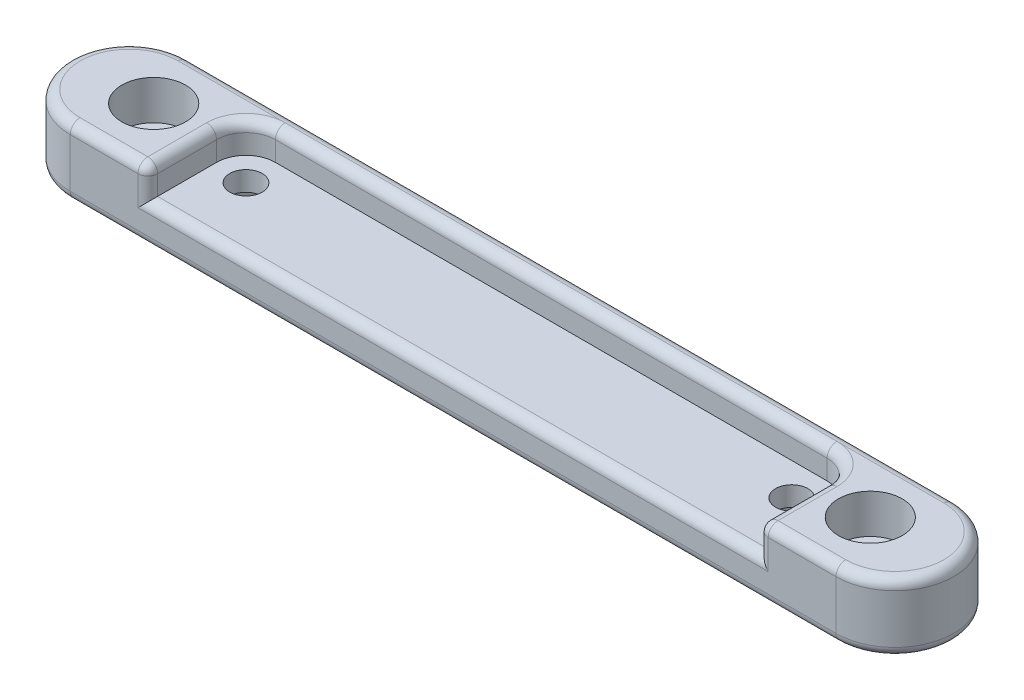
from build123d import *

# Parameters (mm, degrees)
ESQUISSE1_W             = 62.2
ESQUISSE1_H             = 10
ESQUISSE1_R             = 1.65
BOSS_EXTRU_1_DEPTH      = 4
BOSS_EXTRU_2_DEPTH      = 3
BOSS_EXTRU_2_DEPTH_BACK = 4
CONG_1_R                = 3
ESQUISSE3_R             = 1.65
BOSS_EXTRU_3_DEPTH      = 7
ENL_V_MAT_EXTRU_1_DEPTH = 2
ESQUISSE6_R             = 3.25
ENL_V_MAT_EXTRU_2_DEPTH = 4
CONG_2_R                = 1


with BuildPart() as part:
    # Esquisse1 → Boss.-Extru.1 (new body)
    with BuildSketch(Plane(origin=(0, 0, 0), x_dir=(1, 0, 0), z_dir=(0, 1, 0))):
        with Locations((0, -1.7)):
            Rectangle(ESQUISSE1_W, ESQUISSE1_H)
        with Locations(Location((-27.8, 0, 0), (0, 0, 270))):
            Circle(ESQUISSE1_R, mode=Mode.SUBTRACT)
        with Locations(Location((27.8, 0, 0), (0, 0, 270))):
            Circle(ESQUISSE1_R, mode=Mode.SUBTRACT)
    extrude(amount=BOSS_EXTRU_1_DEPTH)

    # Esquisse2 → Boss.-Extru.2 (add, two sides: drawn at the far end of the back side and taken through both)
    with BuildSketch(Plane(origin=(0, 4, 0), x_dir=(1, 0, 0), z_dir=(0, 1, 0)).offset(-BOSS_EXTRU_2_DEPTH_BACK)):
        Polygon((-31.1, -6.7), (-31.1, 3.3), (31.1, 3.3), (31.1, -6.7), (33.5, -6.7), (33.5, 5.3), (-33.5, 5.3), (-33.5, -6.7), align=None)
    extrude(amount=BOSS_EXTRU_2_DEPTH + BOSS_EXTRU_2_DEPTH_BACK)

    # Congé1
    cong_1_edges = [part.edges().sort_by_distance(p)[0] for p in [
        (31.1, 5.5, -3.3),
        (-31.1, 5.5, -3.3),
    ]]
    fillet(cong_1_edges, radius=CONG_1_R)

    # Esquisse3 → Boss.-Extru.3 (add)
    # profile 1 of 2: a face of its own
    with BuildSketch(Plane(origin=(0, 7, 0), x_dir=(1, 0, 0), z_dir=(0, 1, 0))):
        with BuildLine():
            Line((-39, 5.3), (-33.5, 5.3))
            Line((-33.5, 5.3), (-33.5, -6.7))
            Line((-33.5, -6.7), (-39, -6.7))
            ThreePointArc((-39, -6.7), (-45, -0.7), (-39, 5.3))
        make_face()
        with Locations(Location((-36.5, -0.7, 0), (0, 0, 270))):
            Circle(ESQUISSE3_R, mode=Mode.SUBTRACT)
    # profile 2 of 2: a face of its own
    with BuildSketch(Plane(origin=(0, 7, 0), x_dir=(1, 0, 0), z_dir=(0, 1, 0))):
        with BuildLine():
            Line((33.5, 5.3), (33.5, -6.7))
            Line((33.5, -6.7), (39, -6.7))
            ThreePointArc((39, -6.7), (45, -0.7), (39, 5.3))
            Line((39, 5.3), (33.5, 5.3))
        make_face()
        with Locations(Location((36.5, -0.7, 0), (0, 0, 90))):
            Circle(ESQUISSE3_R, mode=Mode.SUBTRACT)
    extrude(amount=-BOSS_EXTRU_3_DEPTH)

    # Esquisse5 → Enlèv. mat.-Extru.1 (cut)
    with BuildSketch(Plane.XZ):
        Polygon((-29.445448267, 2.85), (-26.154551733, 2.85), (-24.509103466, 0), (-26.154551733, -2.85), (-29.445448267, -2.85), (-31.090896534, 0), align=None)
        Polygon((26.154551733, 2.85), (29.445448267, 2.85), (31.090896534, 0), (29.445448267, -2.85), (26.154551733, -2.85), (24.509103466, 0), align=None)
    extrude(amount=-ENL_V_MAT_EXTRU_1_DEPTH, mode=Mode.SUBTRACT)

    # Esquisse6 → Enlèv. mat.-Extru.2 (cut)
    with BuildSketch(Plane(origin=(0, 7, 0), x_dir=(1, 0, 0), z_dir=(0, 1, 0))):
        with Locations(Location((-36.5, -0.7, 0), (0, 0, 270))):
            Circle(ESQUISSE6_R)
        with Locations(Location((36.5, -0.7, 0), (0, 0, 270))):
            Circle(ESQUISSE6_R)
    extrude(amount=-ENL_V_MAT_EXTRU_2_DEPTH, mode=Mode.SUBTRACT)

    # Congé2
    cong_2_edges = [part.edges().sort_by_distance(p)[0] for p in [
        (0, 4, 6.7),
        (31.1, 5.5, 6.7),
        (0, 0, -5.3),
        (-31.1, 5.5, 6.7),
        (-35.05, 7, 6.7),
        (-31.1, 7, 3.2),
        (35.05, 7, 6.7),
        (0, 7, -5.3),
        (0, 7, -3.3),
        (31.1, 7, 3.2),
        (0, 0, 6.7),
        (30.221320344, 7, -2.421320344),
        (-30.221320344, 7, -2.421320344),
        (-45, 0, 0.7),
        (-45, 7, 0.7),
        (45, 0, 0.7),
        (45, 7, 0.7),
    ]]
    fillet(cong_2_edges, radius=CONG_2_R - 0.0001)  # a hair under: the kernel refuses the full size


solid = part.part
